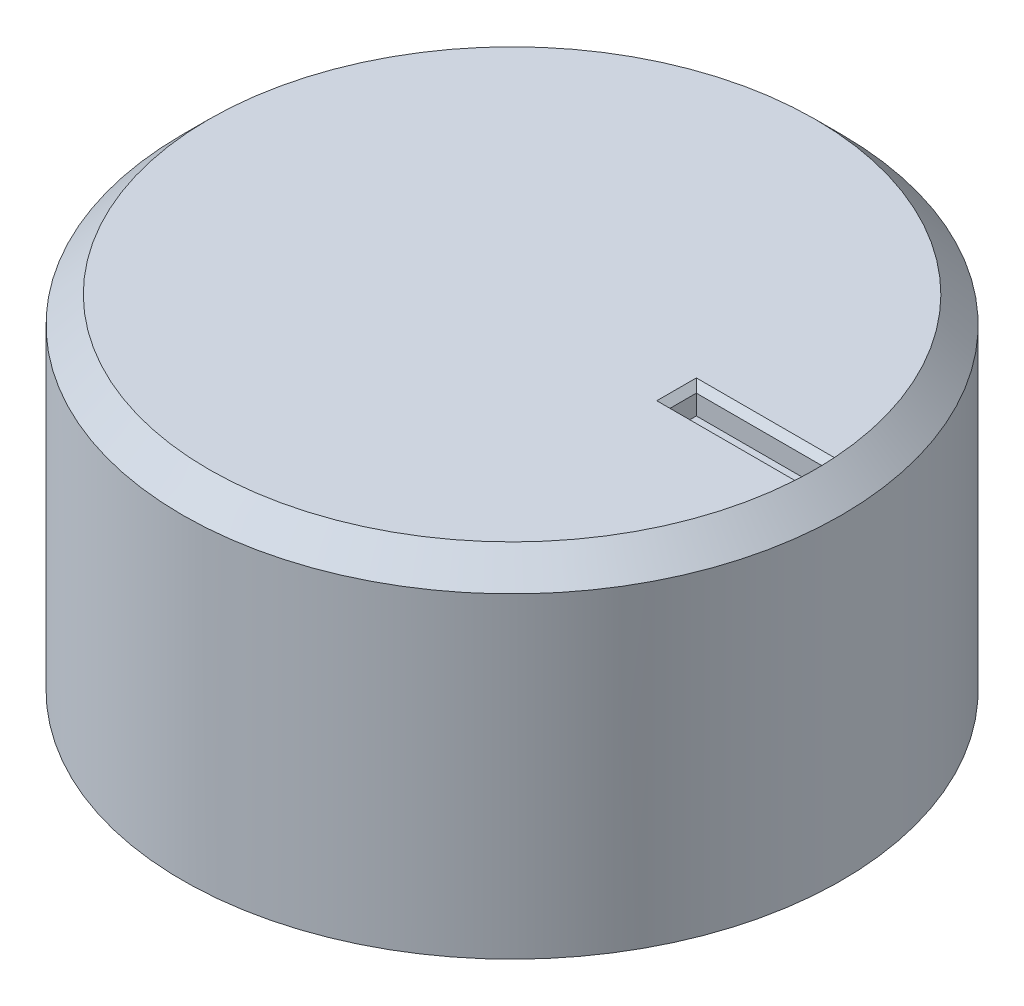
from build123d import *

# Parameters (mm, degrees)
SKETCH1_R           = 3.5
BOSS_EXTRUDE1_DEPTH = 10
SKETCH2_R           = 12.5
BOSS_EXTRUDE2_DEPTH = 1
BOSS_EXTRUDE3_START = 9
SKETCH3_R           = 12.5
SKETCH3_R_2         = 11.5
BOSS_EXTRUDE3_DEPTH = 9
BOSS_EXTRUDE4_START = 12
SKETCH3_4_R         = 12.5
SKETCH3_4_R_2       = 11.5
BOSS_EXTRUDE4_DEPTH = 12
CHAMFER1_SIZE       = 1
CUT_EXTRUDE4_START  = -1
CUT_EXTRUDE4_DEPTH  = 1
CHAMFER2_SIZE       = 0.25


with BuildPart() as part:
    # Sketch1 → Boss-Extrude1 (new body)
    with BuildSketch(Plane(origin=(0, 0, 0), x_dir=(1, 0, 0), z_dir=(0, 1, 0))):
        with Locations(Location((0, 0, 0), (0, 0, 270))):
            Circle(SKETCH1_R)
        with BuildLine():
            Line((-1.75, 1.038612788), (1.75, 1.038612788))
            Line((1.75, 1.038612788), (1.75, 2.738612788))
            ThreePointArc((1.75, 2.738612788), (0, -3.25), (-1.75, 2.738612788))
            Line((-1.75, 2.738612788), (-1.75, 1.038612788))
        make_face(mode=Mode.SUBTRACT)
    extrude(amount=BOSS_EXTRUDE1_DEPTH)

    # Sketch2 → Boss-Extrude2 (add)
    with BuildSketch(Plane(origin=(0, 10, 0), x_dir=(1, 0, 0), z_dir=(0, 1, 0))):
        with Locations(Location((0, 0, 0), (0, 0, 270))):
            Circle(SKETCH2_R)
    extrude(amount=BOSS_EXTRUDE2_DEPTH)

    # Sketch3 → Boss-Extrude3 (add)
    # profile 1 of 8: a face of its own
    with BuildSketch(Plane.XZ.offset(-10).offset(BOSS_EXTRUDE3_START)):
        with Locations(Location((0, 0, 0), (0, 0, 270))):
            Circle(SKETCH3_R)
        Circle(SKETCH3_R_2, mode=Mode.SUBTRACT)
    # profile 2 of 8: a face of its own
    with BuildSketch(Plane.XZ.offset(-10).offset(BOSS_EXTRUDE3_START)):
        with BuildLine():
            Line((-6.594245022, 9.421567416), (-2.543076387, 2.40473751))
            ThreePointArc((-2.543076387, 2.40473751), (-1.75, 3.031088913), (-0.811025579, 3.40473751))
            Line((-0.811025579, 3.40473751), (-4.862194215, 10.421567416))
            ThreePointArc((-4.862194215, 10.421567416), (-5.75, 9.959292144), (-6.594245022, 9.421567416))
        make_face()
    # profile 3 of 8: a face of its own
    with BuildSketch(Plane.XZ.offset(-10).offset(BOSS_EXTRUDE3_START)):
        with BuildLine():
            Line((-11.5, 0), (-3.5, 0))
            ThreePointArc((-3.5, 0), (-3.463333429, 0.505293538), (-3.354101966, 1))
            Line((-3.354101966, 1), (-11.456439237, 1))
            ThreePointArc((-11.456439237, 1), (-11.489104648, 0.50047416), (-11.5, 0))
        make_face()
    # profile 4 of 8: a face of its own
    with BuildSketch(Plane.XZ.offset(-10).offset(BOSS_EXTRUDE3_START)):
        with BuildLine():
            ThreePointArc((-3.354101966, -1), (-3.463333429, -0.505293538), (-3.5, 0))
            Line((-3.5, 0), (-11.5, 0))
            ThreePointArc((-11.5, 0), (-11.489104648, -0.50047416), (-11.456439237, -1))
            Line((-11.456439237, -1), (-3.354101966, -1))
        make_face()
    # profile 5 of 8: a face of its own
    with BuildSketch(Plane.XZ.offset(-10).offset(BOSS_EXTRUDE3_START)):
        with BuildLine():
            Line((11.456439237, 1), (3.354101966, 1))
            ThreePointArc((3.354101966, 1), (3.463333429, 0.505293538), (3.5, 0))
            ThreePointArc((3.5, 0), (3.463333429, -0.505293538), (3.354101966, -1))
            Line((3.354101966, -1), (11.456439237, -1))
            ThreePointArc((11.456439237, -1), (11.489104648, -0.50047416), (11.5, 0))
            ThreePointArc((11.5, 0), (11.489104648, 0.50047416), (11.456439237, 1))
        make_face()
    # profile 6 of 8: a face of its own
    with BuildSketch(Plane.XZ.offset(-10).offset(BOSS_EXTRUDE3_START)):
        with BuildLine():
            ThreePointArc((2.543076387, -2.40473751), (1.75, -3.031088913), (0.811025579, -3.40473751))
            Line((0.811025579, -3.40473751), (4.862194215, -10.421567416))
            ThreePointArc((4.862194215, -10.421567416), (5.75, -9.959292144), (6.594245022, -9.421567416))
            Line((6.594245022, -9.421567416), (2.543076387, -2.40473751))
        make_face()
    # profile 7 of 8: a face of its own
    with BuildSketch(Plane.XZ.offset(-10).offset(BOSS_EXTRUDE3_START)):
        with BuildLine():
            ThreePointArc((-0.811025579, -3.40473751), (-1.75, -3.031088913), (-2.543076387, -2.40473751))
            Line((-2.543076387, -2.40473751), (-6.594245022, -9.421567416))
            ThreePointArc((-6.594245022, -9.421567416), (-5.75, -9.959292144), (-4.862194215, -10.421567416))
            Line((-4.862194215, -10.421567416), (-0.811025579, -3.40473751))
        make_face()
    # profile 8 of 8: a face of its own
    with BuildSketch(Plane.XZ.offset(-10).offset(BOSS_EXTRUDE3_START)):
        with BuildLine():
            Line((4.862194215, 10.421567416), (0.811025579, 3.40473751))
            ThreePointArc((0.811025579, 3.40473751), (1.75, 3.031088913), (2.543076387, 2.40473751))
            Line((2.543076387, 2.40473751), (6.594245022, 9.421567416))
            ThreePointArc((6.594245022, 9.421567416), (5.75, 9.959292144), (4.862194215, 10.421567416))
        make_face()
    extrude(amount=-BOSS_EXTRUDE3_DEPTH)

    # Sketch3<4> → Boss-Extrude4 (add)
    with BuildSketch(Plane.XZ.offset(-10).offset(BOSS_EXTRUDE4_START)):
        with Locations(Location((0, 0, 0), (0, 0, 270))):
            Circle(SKETCH3_4_R)
        with Locations(Location((0, 0, 0), (0, 0, 64.988541976))):
            Circle(SKETCH3_4_R_2, mode=Mode.SUBTRACT)
    extrude(amount=-BOSS_EXTRUDE4_DEPTH)

    # Chamfer1
    chamfer1_edges = [part.edges().sort_by_distance(p)[0] for p in [
        (0, 11, -12.5),
    ]]
    chamfer(chamfer1_edges, length=CHAMFER1_SIZE - 0.0001)  # a hair under: the kernel refuses the full size

    # Sketch4 → Cut-Extrude4 (cut)
    with BuildSketch(Plane(origin=(0, 11, 0), x_dir=(1, 0, 0), z_dir=(0, 1, 0)).offset(CUT_EXTRUDE4_START)):
        with BuildLine():
            Line((6.489125293, 0.5), (6.489125293, 0))
            Line((6.489125293, 0), (11.5, 0))
            ThreePointArc((11.5, 0), (11.497281002, 0.250059123), (11.489125293, 0.5))
            Line((11.489125293, 0.5), (6.489125293, 0.5))
        make_face()
        with BuildLine():
            Line((11.5, 0), (6.489125293, 0))
            Line((6.489125293, 0), (6.489125293, -0.5))
            Line((6.489125293, -0.5), (11.489125293, -0.5))
            ThreePointArc((11.489125293, -0.5), (11.497281002, -0.250059123), (11.5, 0))
        make_face()
    extrude(amount=CUT_EXTRUDE4_DEPTH, mode=Mode.SUBTRACT)

    # Chamfer2
    chamfer2_edges = [part.edges().sort_by_distance(p)[0] for p in [
        (6.489125293, 11, 0),
        (8.989125293, 11, -0.5),
        (8.989125293, 11, 0.5),
    ]]
    chamfer(chamfer2_edges, length=CHAMFER2_SIZE)


solid = part.part
